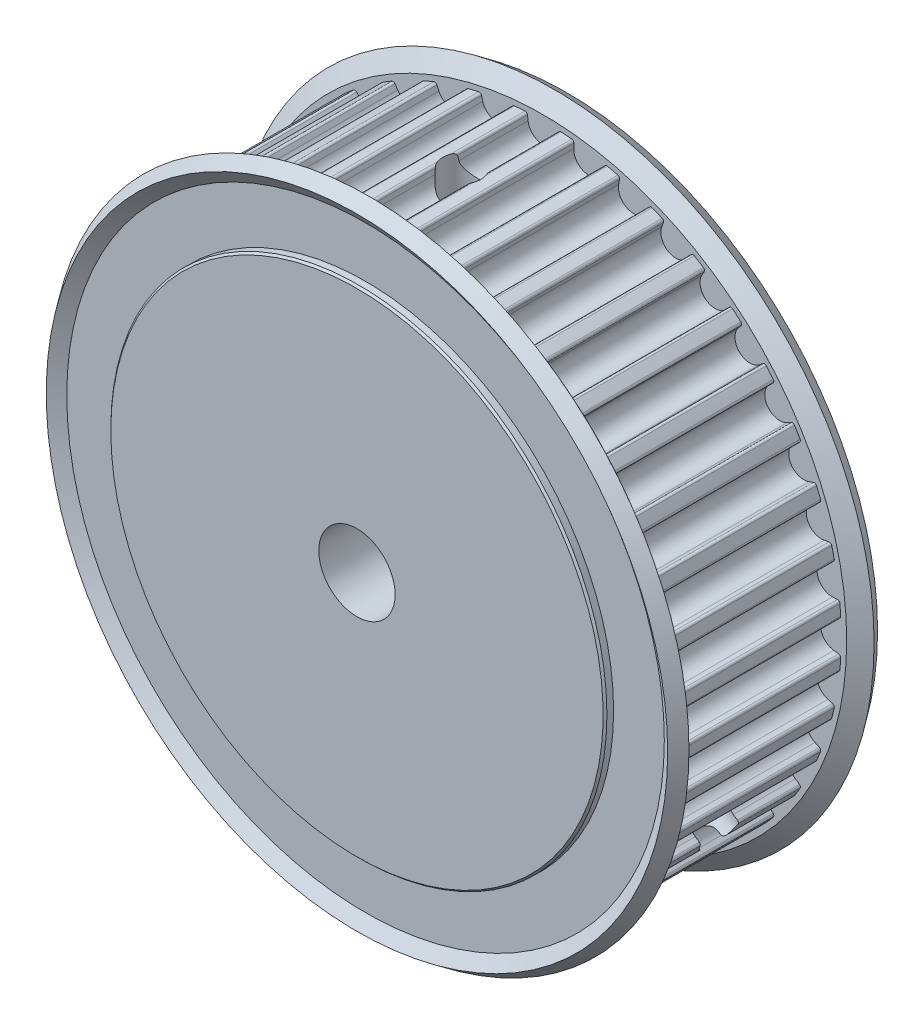
from build123d import *
from build123d.topology import SkipClean

# Parameters (mm, degrees)
CUT_EXTRUDE_START        = 8.5
CUT_EXTRUDE_1_DEPTH      = 17
PATTERN_CIRCULAR_1_COUNT = 40
CUT_EXTRUDE_START_2      = -11
CUT_EXTRUDE_N_DEPTH      = 22
EXTRUDE_START            = -11
EXTRUDE_P_DEPTH          = 22
SKETCH_7_R               = 2
CUT_EXTRUDE_1_2_DEPTH    = 31.26
PATTERN_CIRCULAR_2_COUNT = 2
PATTERN_CIRCULAR_2_ANGLE = 120
CHAMFER_1_SIZE           = 0.2


with BuildPart() as part:
    # 草图3 → 旋转1 (revolve)
    with BuildSketch(Plane(origin=(0, 0, 0), x_dir=(0, 0, -1), z_dir=(1, 0, 0)), mode=Mode.PRIVATE) as revolve_1_sk:
        Polygon((-11, 26), (-11, 0), (11, 0), (11, 26), (10.1, 26), (10.1, 31.314396856), (11, 32.565806298), (9.701045756, 33.5), (8.5, 31.83), (8.5, 31.26), (-8.5, 31.26), (-8.5, 31.83), (-9.701045756, 33.5), (-11, 32.565806298), (-10.1, 31.314396856), (-10.1, 26), align=None)
    revolve(revolve_1_sk.sketch.rotate(Axis((0, 0, 34.781081475), (0, 0, -1)), 90), axis=Axis((0, 0, 34.781081475), (0, 0, -1)))

    # 草图4 → Cut-Extrude 1 (cut)
    with BuildSketch(Plane.XY.offset(CUT_EXTRUDE_START)):
        with BuildLine():
            Line((-1.563541648, 30.483304798), (-1.625, 30.983842911))
            ThreePointArc((-1.625, 30.983842911), (-1.713214764, 31.145534432), (-1.888237606, 31.202919074))
            ThreePointArc((-1.888237606, 31.202919074), (0, 31.26), (1.888237606, 31.202919074))
            ThreePointArc((1.888237606, 31.202919074), (1.713214764, 31.145534432), (1.625, 30.983842911))
            Line((1.625, 30.983842911), (1.563541648, 30.483304798))
            ThreePointArc((1.563541648, 30.483304798), (0, 29.1), (-1.563541648, 30.483304798))
        make_face()
    cut_extrude_1 = extrude(amount=-CUT_EXTRUDE_1_DEPTH, mode=Mode.SUBTRACT)

    # 阵列(圆周)1: Cut-Extrude 1 ×40 about axis
    pattern_circular_1_axis = Axis((0, 0, 0), (0, 0, 1))
    for i in range(1, PATTERN_CIRCULAR_1_COUNT):
        add(cut_extrude_1.rotate(pattern_circular_1_axis, i * 360 / PATTERN_CIRCULAR_1_COUNT), mode=Mode.SUBTRACT)

    # 草图6 → N (cut)
    with BuildSketch(Plane.XY.offset(CUT_EXTRUDE_START_2)):
        with BuildLine():
            Line((-1.5, 5.4), (1.5, 5.4))
            Line((1.5, 5.4), (1.5, 3.708099244))
            ThreePointArc((1.5, 3.708099244), (0, -4), (-1.5, 3.708099244))
            Line((-1.5, 3.708099244), (-1.5, 5.4))
        make_face()
    extrude(amount=CUT_EXTRUDE_N_DEPTH, mode=Mode.SUBTRACT)

    # 草图8 → P (add)
    with SkipClean():  # the faces are left unmerged after this step: merging them gives an invalid solid
        with BuildSketch(Plane.XY.offset(EXTRUDE_START)):
            with BuildLine():
                Line((-1.5, 3.708099244), (-1.5, 5.4))
                Line((-1.5, 5.4), (1.5, 5.4))
                Line((1.5, 5.4), (1.5, 3.708099244))
                ThreePointArc((1.5, 3.708099244), (0, 4), (-1.5, 3.708099244))
            make_face()
        extrude(amount=EXTRUDE_P_DEPTH)

    # 草图7 → Cut-Extrude 1 2 (cut)
    with SkipClean():  # the faces are left unmerged after this step: merging them gives an invalid solid
        with BuildSketch(Plane(origin=(0, 0, 0), x_dir=(1, 0, 0), z_dir=(0, 1, 0))):
            with Locations(Location((0, 0, 0), (0, 0, 90))):
                Circle(SKETCH_7_R)
        cut_extrude_1_2 = extrude(amount=CUT_EXTRUDE_1_2_DEPTH, mode=Mode.SUBTRACT)

    # 螺纹孔2: Cut-Extrude 1 2 ×2 about axis
    with SkipClean():  # the faces are left unmerged after this step: merging them gives an invalid solid
        pattern_circular_2_axis = Axis((0, 0, 34.781081475), (0, 0, -1))
        for i in range(1, PATTERN_CIRCULAR_2_COUNT):
            add(cut_extrude_1_2.rotate(pattern_circular_2_axis, i * PATTERN_CIRCULAR_2_ANGLE / (PATTERN_CIRCULAR_2_COUNT - 1)), mode=Mode.SUBTRACT)

    # 倒角1
    chamfer_1_edges = [part.edges().sort_by_distance(p)[0] for p in [
        (-26, 0, -11),
        (-26, 0, 11),
    ]]
    chamfer(chamfer_1_edges, length=CHAMFER_1_SIZE)


solid = part.part
